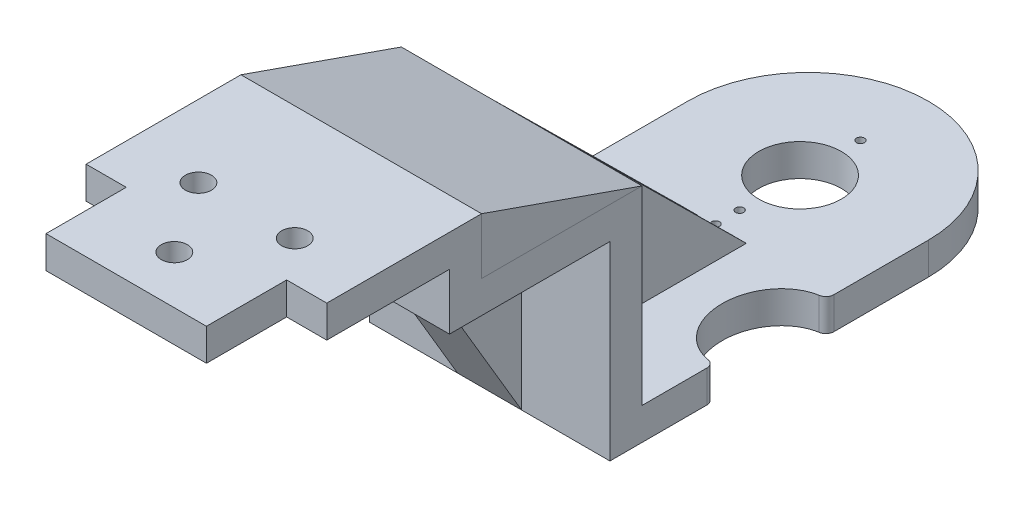
from build123d import *

# Parameters (mm, degrees)
SKETCH_1_R           = 1.625
EXTRUDE_1_DEPTH      = 4
SKETCH_2_W           = 30
SKETCH_2_H           = 11
EXTRUDE_2_DEPTH      = 4
SKETCH_3_W           = 30
SKETCH_3_H           = 24
EXTRUDE_3_DEPTH      = 4
EXTRUDE_4_DEPTH      = 30
SKETCH_5_W           = 4
SKETCH_5_H           = 23.7
EXTRUDE_5_DEPTH      = 30
SKETCH_6_W           = 30.00005
SKETCH_6_H           = 54.7
SKETCH_6_R           = 5.15
EXTRUDE_6_DEPTH      = 4
CUT_EXTRUDE_1_REACH  = 108.907
SKETCH_8_RX          = 7
SKETCH_8_RY          = 6
FILLET_START         = -32
FILLET_2_DEPTH       = 6
FILLET_3_R           = 15
EXTRUDE_8_DEPTH      = 4
EXTRUDE_8_DEPTH_BACK = 4
EXTRUDE_9_DEPTH      = 4
EXTRUDE_9_DEPTH_BACK = 4
SKETCH_13_R          = 0.5
CUT_EXTRUDE_2_DEPTH  = 20
SKETCH_14_W          = 4
SKETCH_14_H          = 8
CUT_EXTRUDE_3_DEPTH  = 10


with BuildPart() as part:
    # Эскиз1 → Бобышка-Вытянуть1 (new body)
    with BuildSketch(Plane(origin=(0, 0, 0), x_dir=(1, 0, 0), z_dir=(0, 1, 0))):
        Polygon((-10, 0), (10, 0), (10, 10), (15, 10), (15, 25.3), (-15, 25.3), (-15, 10), (-10, 10), align=None)
        with Locations(Location((-6, 15, 0), (0, 0, 270))):
            Circle(SKETCH_1_R, mode=Mode.SUBTRACT)
        with Locations(Location((0, 6, 0), (0, 0, 270))):
            Circle(SKETCH_1_R, mode=Mode.SUBTRACT)
        with Locations(Location((6, 15, 0), (0, 0, 90))):
            Circle(SKETCH_1_R, mode=Mode.SUBTRACT)
    extrude(amount=EXTRUDE_1_DEPTH)

    # Эскиз2 → Бобышка-Вытянуть2 (add)
    with BuildSketch(Plane(origin=(0, 0, -25.3), x_dir=(-1, 0, 0), z_dir=(0, 0, -1))):
        with Locations((0, -1.5)):
            Rectangle(SKETCH_2_W, SKETCH_2_H)
    extrude(amount=EXTRUDE_2_DEPTH)

    # Эскиз3 → Бобышка-Вытянуть3 (add)
    with BuildSketch(Plane.XZ.offset(7)):
        with Locations((0, -37.3)):
            Rectangle(SKETCH_3_W, SKETCH_3_H)
    extrude(amount=-EXTRUDE_3_DEPTH)

    # Эскиз4 → Бобышка-Вытянуть4 (add, through all)
    with BuildSketch(Plane.ZY.offset(15)):
        Polygon((-29.3, 4), (-29.3, -3), (-49.3, -3), align=None)
    extrude(amount=-EXTRUDE_4_DEPTH)

    # Эскиз5 → Бобышка-Вытянуть5 (add, through all)
    with BuildSketch(Plane(origin=(15, 0, 0), x_dir=(0, 0, -1), z_dir=(1, 0, 0))):
        with Locations((47.3, -18.85)):
            Rectangle(SKETCH_5_W, SKETCH_5_H)
    extrude(amount=-EXTRUDE_5_DEPTH)

    # Эскиз6 → Бобышка-Вытянуть6 (add)
    with BuildSketch(Plane.XZ.offset(30.7)):
        with Locations((-2.5e-05, -72.65)):
            Rectangle(SKETCH_6_W, SKETCH_6_H)
        with Locations(Location((-2.5e-05, -84, 0), (0, 0, 270))):
            Circle(SKETCH_6_R, mode=Mode.SUBTRACT)
    extrude(amount=-EXTRUDE_6_DEPTH)

    # Эскиз8 → Вырез-Вытянуть1 (cut, up to next)
    with BuildSketch(Plane.XZ.offset(30.7), mode=Mode.PRIVATE) as cut_extrude_1_sk1:
        with Locations(Location((15, -65.3), (0, 0, -90))):
            Ellipse(SKETCH_8_RX, SKETCH_8_RY)
    cut_extrude_1_tool1 = extrude(cut_extrude_1_sk1.sketch, amount=-CUT_EXTRUDE_1_REACH, mode=Mode.PRIVATE) & part.part
    # Эскиз8 → Вырез-Вытянуть1 (cut, up to next)
    with BuildSketch(Plane.XZ.offset(30.7), mode=Mode.PRIVATE) as cut_extrude_1_sk2:
        with Locations(Location((-15.000018282, -65.299986289), (0, 0, -90.000052373))):
            Ellipse(SKETCH_8_RX, SKETCH_8_RY)
    cut_extrude_1_tool2 = extrude(cut_extrude_1_sk2.sketch, amount=-CUT_EXTRUDE_1_REACH, mode=Mode.PRIVATE) & part.part
    add(cut_extrude_1_tool1.solids().sort_by_distance((15, -30.7, -65.3))[0], mode=Mode.SUBTRACT)
    add(cut_extrude_1_tool2.solids().sort_by_distance((-15.000018, -30.7, -65.299986))[0], mode=Mode.SUBTRACT)

    # Скругление2: read off the stored shape, not the designer's step
    # Скругление2 outline → Скругление2 (cut)
    with BuildSketch(Plane(origin=(0, 0, 0), x_dir=(1, 0, 0), z_dir=(0, 1, 0)).offset(FILLET_START)):
        with BuildLine():
            Line((15, 72.3), (15, 73.218180859))
            ThreePointArc((15, 73.218180859), (14.762336304, 72.570999772), (14.162313281, 72.231441583))
            add(Edge.make_bspline(
                [(14.162313281, 72.231441583), (14.579095458, 72.3), (15, 72.3)],
                knots=[6.131749827, 6.131749827, 6.131749827, 6.283185307, 6.283185307, 6.283185307], degree=2, weights=[0.948970652, 0.971763096, 1]))
        make_face()
        with BuildLine():
            add(Edge.make_bspline(
                [(15, 58.3), (14.579095458, 58.3), (14.162313281, 58.368558417)],
                knots=[3.141592654, 3.141592654, 3.141592654, 3.293028134, 3.293028134, 3.293028134], degree=2, weights=[1, 0.971763096, 0.948970652]))
            ThreePointArc((14.162313281, 58.368558417), (14.762336304, 58.029000228), (15, 57.381819141))
            Line((15, 57.381819141), (15, 58.3))
        make_face()
        with BuildLine():
            add(Edge.make_bspline(
                [(-15.00005, 72.299986289), (-14.579143154, 72.299988746), (-14.162358429, 72.231432015)],
                knots=[6.283181087, 6.283181087, 6.283181087, 6.434617466, 6.434617466, 6.434617466], degree=2, weights=[1, 0.971762843, 0.948970209]))
            ThreePointArc((-14.162358429, 72.231432015), (-14.762384713, 72.570989127), (-15.00005, 73.218172089))
            Line((-15.00005, 73.218172089), (-15.00005, 72.299986289))
        make_face()
        with BuildLine():
            ThreePointArc((-15.00005, 57.381799936), (-14.762384538, 58.028983103), (-14.162357897, 58.368540098))
            add(Edge.make_bspline(
                [(-14.162357897, 58.368540098), (-14.579142884, 58.299983554), (-15.00005, 58.299986289)],
                knots=[9.27334784, 9.27334784, 9.27334784, 9.424784314, 9.424784314, 9.424784314], degree=2, weights=[0.948970181, 0.971762826, 1]))
            Line((-15.00005, 58.299986289), (-15.00005, 57.381799936))
        make_face()
    extrude(amount=FILLET_2_DEPTH, mode=Mode.SUBTRACT)

    # Скругление3
    fillet_3_edges = [part.edges().sort_by_distance(p)[0] for p in [
        (-15.00005, -28.7, -100),
        (15, -28.7, -100),
    ]]
    fillet(fillet_3_edges, radius=FILLET_3_R)

    # Эскиз10 → Бобышка-Вытянуть8 (add, two sides: drawn at the far end of the back side and taken through both)
    with BuildSketch(Plane.ZY.offset(2.5e-05).offset(-EXTRUDE_8_DEPTH_BACK)):
        Polygon((-49.3, -26.7), (-73.3, -26.7), (-49.3, -3), align=None)
    extrude(amount=EXTRUDE_8_DEPTH + EXTRUDE_8_DEPTH_BACK)

    # Эскиз11 → Бобышка-Вытянуть9 (add, two sides: drawn at the far end of the back side and taken through both)
    with BuildSketch(Plane.ZY.offset(2.5e-05).offset(-EXTRUDE_9_DEPTH_BACK)):
        Polygon((-31.3, -7), (-45.3, -7), (-45.3, -30.7), align=None)
    extrude(amount=EXTRUDE_9_DEPTH + EXTRUDE_9_DEPTH_BACK)

    # Эскиз13 → Вырез-Вытянуть2 (cut)
    with BuildSketch(Plane.XZ.offset(30.7)):
        with Locations(Location((-1.0754e-05, -76.47, 0), (0, 0, 270))):
            Circle(SKETCH_13_R)
        with Locations(Location((-1.2125e-05, -73.47, 0), (0, 0, 270))):
            Circle(SKETCH_13_R)
        with Locations(Location((-1.3496e-05, -70.47, 0), (0, 0, 270))):
            Circle(SKETCH_13_R)
        with Locations(Location((-1.4867e-05, -67.47, 0), (0, 0, 270))):
            Circle(SKETCH_13_R)
        with Locations(Location((-3.871e-06, -91.53, 0), (0, 0, 270))):
            Circle(SKETCH_13_R)
    extrude(amount=-CUT_EXTRUDE_2_DEPTH, mode=Mode.SUBTRACT)

    # Эскиз14 → Вырез-Вытянуть3 (cut)
    with BuildSketch(Plane(origin=(0, -26.7, 0), x_dir=(1, 0, 0), z_dir=(0, 1, 0))):
        with Locations((-2.5e-05, 69.3)):
            Rectangle(SKETCH_14_W, SKETCH_14_H)
    extrude(amount=CUT_EXTRUDE_3_DEPTH, mode=Mode.SUBTRACT)


solid = part.part
